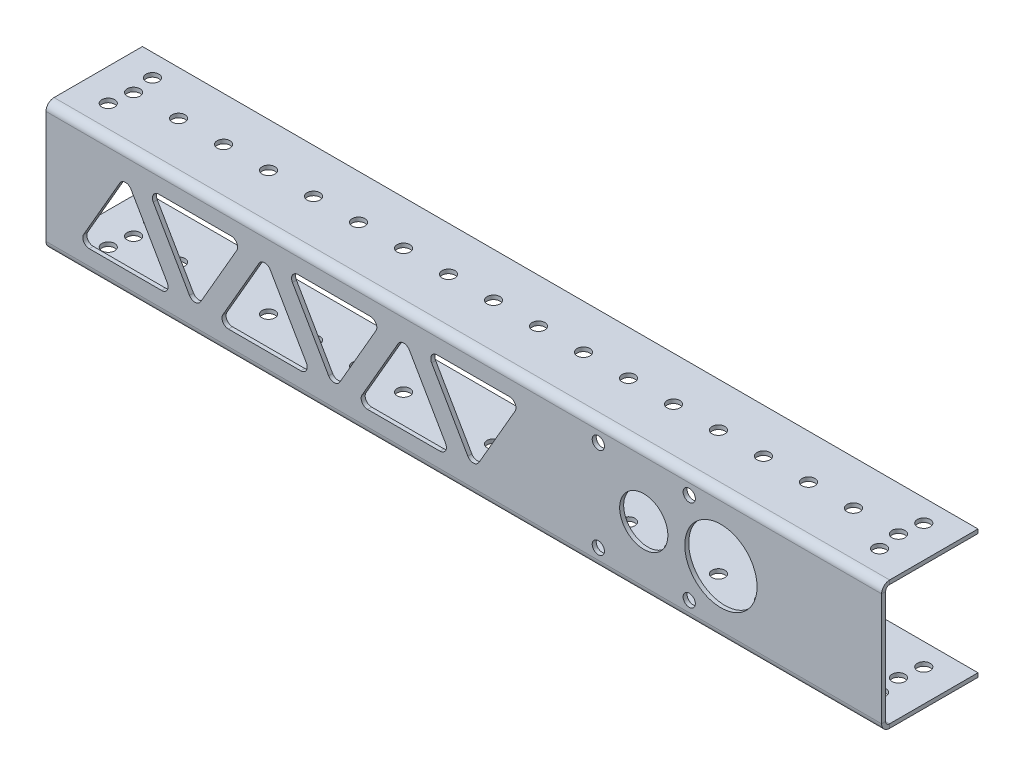
from build123d import *

# Parameters (mm, degrees)
BASE_FLANGE2_DEPTH = 165.1
SKETCH10_R         = 2.54
CUT_EXTRUDE1_DEPTH = 174.785938729
SKETCH11_R         = 14.2875
SKETCH11_R_2       = 9.525
SKETCH11_R_3       = 2.413
CUT_EXTRUDE2_DEPTH = 172.332367053
CUT_EXTRUDE3_DEPTH = 2.54
SKETCH13_R         = 2.54
CUT_EXTRUDE4_DEPTH = 174.785938729


# Sheet-metal steps are written as plain solids
with BuildPart() as part:
    # Sketch1 → Base-Flange2 (new, symmetric)
    with BuildSketch(Plane(origin=(0, 0, 0), x_dir=(0, 0, -1), z_dir=(1, 0, 0))):
        with BuildLine():
            Line((19.05, -25.4), (-15.875, -25.4))
            ThreePointArc((-15.875, -25.4), (-18.12006403, -24.47006403), (-19.05, -22.225))
            Line((-19.05, -22.225), (-19.05, 22.225))
            ThreePointArc((-19.05, 22.225), (-18.12006403, 24.47006403), (-15.875, 25.4))
            Line((-15.875, 25.4), (19.05, 25.4))
            Line((19.05, 25.4), (19.05, 23.8125))
            Line((19.05, 23.8125), (-15.875, 23.8125))
            ThreePointArc((-15.875, 23.8125), (-16.997532015, 23.347532015), (-17.4625, 22.225))
            Line((-17.4625, 22.225), (-17.4625, -22.225))
            ThreePointArc((-17.4625, -22.225), (-16.997532015, -23.347532015), (-15.875, -23.8125))
            Line((-15.875, -23.8125), (19.05, -23.8125))
            Line((19.05, -23.8125), (19.05, -25.4))
        make_face()
    extrude(amount=BASE_FLANGE2_DEPTH, both=True)

    # Sketch10 → Cut-Extrude1 (cut, through all)
    with BuildSketch(Plane(origin=(0, 25.4, 0), x_dir=(1, 0, 0), z_dir=(0, 1, 0))):
        with Locations(Location((151.13, 1.5875, 0), (0, 0, 270))):
            Circle(SKETCH10_R)
        with Locations(Location((133.35, 1.5875, 0), (0, 0, 270))):
            Circle(SKETCH10_R)
        with Locations(Location((115.57, 1.5875, 0), (0, 0, 270))):
            Circle(SKETCH10_R)
        with Locations(Location((97.79, 1.5875, 0), (0, 0, 270))):
            Circle(SKETCH10_R)
        with Locations(Location((80.01, 1.5875, 0), (0, 0, 270))):
            Circle(SKETCH10_R)
        with Locations(Location((62.23, 1.5875, 0), (0, 0, 270))):
            Circle(SKETCH10_R)
        with Locations(Location((44.45, 1.5875, 0), (0, 0, 270))):
            Circle(SKETCH10_R)
        with Locations(Location((26.67, 1.5875, 0), (0, 0, 270))):
            Circle(SKETCH10_R)
        with Locations(Location((8.89, 1.5875, 0), (0, 0, 270))):
            Circle(SKETCH10_R)
        with Locations(Location((-8.89, 1.5875, 0), (0, 0, 270))):
            Circle(SKETCH10_R)
        with Locations(Location((-26.67, 1.5875, 0), (0, 0, 270))):
            Circle(SKETCH10_R)
        with Locations(Location((-44.45, 1.5875, 0), (0, 0, 270))):
            Circle(SKETCH10_R)
        with Locations(Location((-62.23, 1.5875, 0), (0, 0, 270))):
            Circle(SKETCH10_R)
        with Locations(Location((-80.01, 1.5875, 0), (0, 0, 270))):
            Circle(SKETCH10_R)
        with Locations(Location((-97.79, 1.5875, 0), (0, 0, 270))):
            Circle(SKETCH10_R)
        with Locations(Location((-115.57, 1.5875, 0), (0, 0, 270))):
            Circle(SKETCH10_R)
        with Locations(Location((-133.35, 1.5875, 0), (0, 0, 270))):
            Circle(SKETCH10_R)
        with Locations(Location((-151.13, 1.5875, 0), (0, 0, 270))):
            Circle(SKETCH10_R)
    extrude(amount=-CUT_EXTRUDE1_DEPTH, mode=Mode.SUBTRACT)

    # Sketch11 → Cut-Extrude2 (cut, through all)
    with BuildSketch(Plane.XY.offset(19.05)):
        with Locations((101.6, 0)):
            Circle(SKETCH11_R)
        with Locations((71.12, 0)):
            Circle(SKETCH11_R_2)
        with Locations((53.159487758, 17.960512242)):
            Circle(SKETCH11_R_3)
        with Locations((89.080512242, 17.960512242)):
            Circle(SKETCH11_R_3)
        with Locations((89.080512242, -17.960512242)):
            Circle(SKETCH11_R_3)
        with Locations((53.159487758, -17.960512242)):
            Circle(SKETCH11_R_3)
    extrude(amount=-CUT_EXTRUDE2_DEPTH, mode=Mode.SUBTRACT)

    # Sketch12 → Cut-Extrude3 (cut)
    with BuildSketch(Plane.XY.offset(19.05)):
        with BuildLine():
            Line((-135.902216058, 12.3825), (-150.200295474, -12.3825))
            ThreePointArc((-150.200295474, -12.3825), (-150.200295474, -14.9225), (-148.000590949, -16.1925))
            Line((-148.000590949, -16.1925), (-119.404432116, -16.1925))
            ThreePointArc((-119.404432116, -16.1925), (-117.20472759, -14.9225), (-117.20472759, -12.3825))
            Line((-117.20472759, -12.3825), (-131.502807007, 12.3825))
            ThreePointArc((-131.502807007, 12.3825), (-133.702511532, 13.6525), (-135.902216058, 12.3825))
        make_face()
        with BuildLine():
            Line((-120.504284379, 16.1925), (-91.908125546, 16.1925))
            ThreePointArc((-91.908125546, 16.1925), (-89.70842102, 14.9225), (-89.70842102, 12.3825))
            Line((-89.70842102, 12.3825), (-104.006500437, -12.3825))
            ThreePointArc((-104.006500437, -12.3825), (-106.206204962, -13.6525), (-108.405909488, -12.3825))
            Line((-108.405909488, -12.3825), (-122.703988904, 12.3825))
            ThreePointArc((-122.703988904, 12.3825), (-122.703988904, 14.9225), (-120.504284379, 16.1925))
        make_face()
        with BuildLine():
            Line((-80.909602918, 12.3825), (-95.207682334, -12.3825))
            ThreePointArc((-95.207682334, -12.3825), (-95.207682334, -14.9225), (-93.007977808, -16.1925))
            Line((-93.007977808, -16.1925), (-64.411818976, -16.1925))
            ThreePointArc((-64.411818976, -16.1925), (-62.21211445, -14.9225), (-62.21211445, -12.3825))
            Line((-62.21211445, -12.3825), (-76.510193866, 12.3825))
            ThreePointArc((-76.510193866, 12.3825), (-78.709898392, 13.6525), (-80.909602918, 12.3825))
        make_face()
        with BuildLine():
            Line((-65.511671238, 16.1925), (-36.915512405, 16.1925))
            ThreePointArc((-36.915512405, 16.1925), (-34.71580788, 14.9225), (-34.71580788, 12.3825))
            Line((-34.71580788, 12.3825), (-49.013887296, -12.3825))
            ThreePointArc((-49.013887296, -12.3825), (-51.213591822, -13.6525), (-53.413296347, -12.3825))
            Line((-53.413296347, -12.3825), (-67.711375764, 12.3825))
            ThreePointArc((-67.711375764, 12.3825), (-67.711375764, 14.9225), (-65.511671238, 16.1925))
        make_face()
        with BuildLine():
            Line((-25.916989777, 12.3825), (-40.215069194, -12.3825))
            ThreePointArc((-40.215069194, -12.3825), (-40.215069194, -14.9225), (-38.015364668, -16.1925))
            Line((-38.015364668, -16.1925), (-9.419205835, -16.1925))
            ThreePointArc((-9.419205835, -16.1925), (-7.21950131, -14.9225), (-7.21950131, -12.3825))
            Line((-7.21950131, -12.3825), (-21.517580726, 12.3825))
            ThreePointArc((-21.517580726, 12.3825), (-23.717285252, 13.6525), (-25.916989777, 12.3825))
        make_face()
        with BuildLine():
            Line((-10.519058098, 16.1925), (18.077100735, 16.1925))
            ThreePointArc((18.077100735, 16.1925), (20.276805261, 14.9225), (20.276805261, 12.3825))
            Line((20.276805261, 12.3825), (5.978725844, -12.3825))
            ThreePointArc((5.978725844, -12.3825), (3.779021318, -13.6525), (1.579316793, -12.3825))
            Line((1.579316793, -12.3825), (-12.718762624, 12.3825))
            ThreePointArc((-12.718762624, 12.3825), (-12.718762624, 14.9225), (-10.519058098, 16.1925))
        make_face()
    extrude(amount=-CUT_EXTRUDE3_DEPTH, mode=Mode.SUBTRACT)

    # Sketch13 → Cut-Extrude4 (cut, through all)
    with BuildSketch(Plane(origin=(0, 25.4, 0), x_dir=(1, 0, 0), z_dir=(0, 1, 0))):
        with Locations(Location((-152.4, 10.31875, 0), (0, 0, 270))):
            Circle(SKETCH13_R)
        with Locations(Location((-152.4, -7.14375, 0), (0, 0, 270))):
            Circle(SKETCH13_R)
        with Locations(Location((152.4, -7.14375, 0), (0, 0, 270))):
            Circle(SKETCH13_R)
        with Locations(Location((152.4, 10.31875, 0), (0, 0, 270))):
            Circle(SKETCH13_R)
    extrude(amount=-CUT_EXTRUDE4_DEPTH, mode=Mode.SUBTRACT)


solid = part.part
